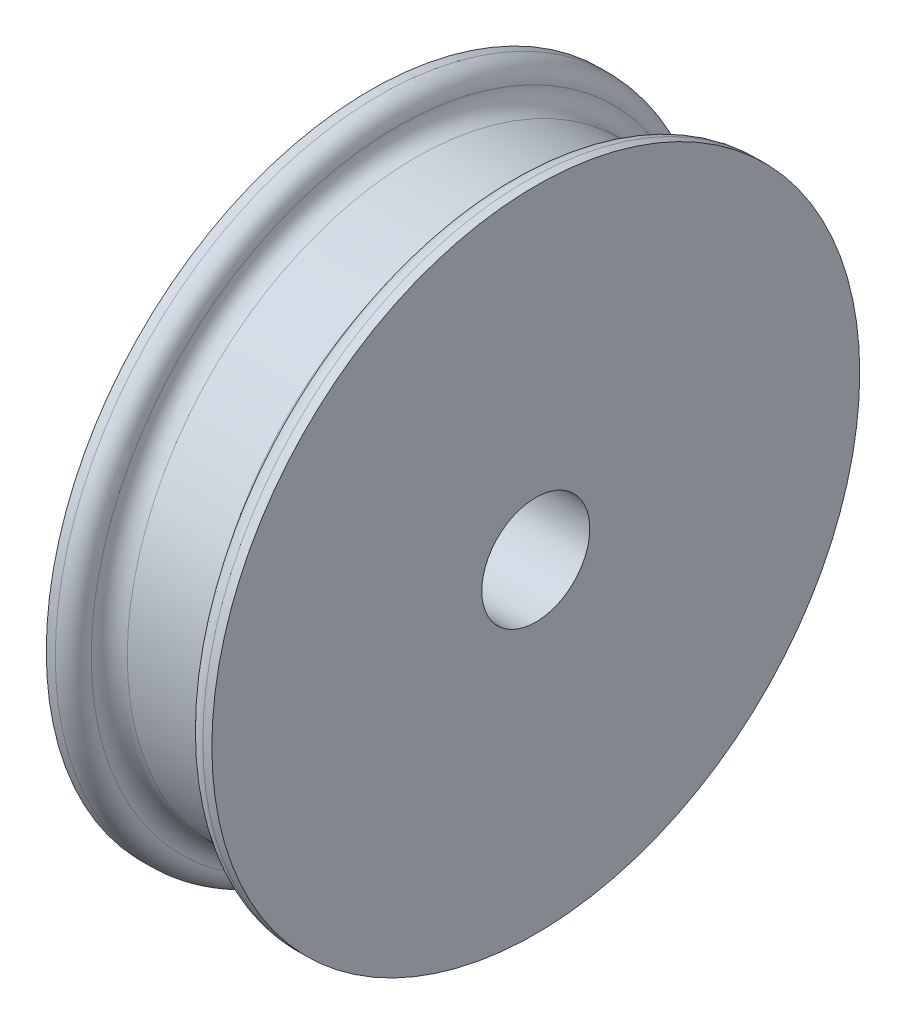
from build123d import *

# Parameters (mm, degrees)
FILLET1_R = 0.5


with BuildPart() as part:
    # Sketch1 → Revolve1 (revolve)
    with BuildSketch(Plane.XY, mode=Mode.PRIVATE) as revolve1_sk:
        with BuildLine():
            Line((-2.3, 1.5), (2.3, 1.5))
            Line((2.3, 1.5), (2.3, 9))
            Line((2.3, 9), (1.55, 9))
            Line((1.55, 9), (1.55, 8.5))
            ThreePointArc((1.55, 8.5), (1.403553391, 8.146446609), (1.05, 8))
            Line((1.05, 8), (-1.05, 8))
            ThreePointArc((-1.05, 8), (-1.403553391, 8.146446609), (-1.55, 8.5))
            Line((-1.55, 8.5), (-1.55, 9))
            Line((-1.55, 9), (-2.3, 9))
            Line((-2.3, 9), (-2.3, 1.5))
        make_face()
    revolve(revolve1_sk.sketch.rotate(Axis((0, 0, 0), (1, 0, 0)), 90), axis=Axis((0, 0, 0), (1, 0, 0)))

    # Fillet1
    fillet1_edges = [part.edges().sort_by_distance(p)[0] for p in [
        (1.55, 0, -9),
        (-1.55, 0, -9),
    ]]
    fillet(fillet1_edges, radius=FILLET1_R - 0.0001)  # a hair under: the kernel refuses the full size


solid = part.part
